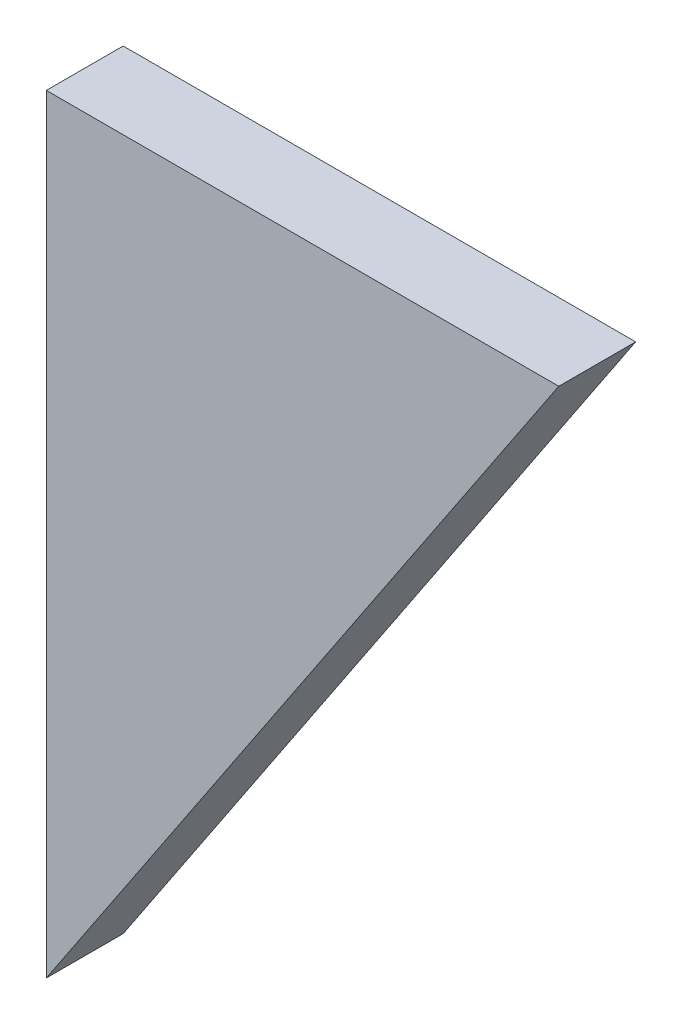
from build123d import *

# Parameters (mm, degrees)
BOSS_EXTRUDE1_DEPTH = 3


with BuildPart() as part:
    # Sketch1 → Boss-Extrude1 (new, symmetric)
    with BuildSketch(Plane.XY):
        Polygon((0, 0), (0, -60), (40, 0), align=None)
    extrude(amount=BOSS_EXTRUDE1_DEPTH, both=True)


solid = part.part
